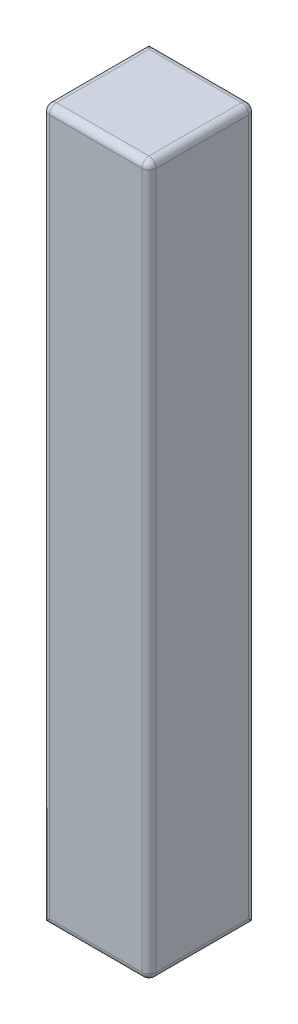
from build123d import *

# Parameters (mm, degrees)
SKETCH1_W           = 3
SKETCH1_H           = 3
BOSS_EXTRUDE1_DEPTH = 20
FILLET1_R           = 0.2


with BuildPart() as part:
    # Sketch1 → Boss-Extrude1 (new body)
    with BuildSketch(Plane(origin=(0, 0, 0), x_dir=(1, 0, 0), z_dir=(0, 1, 0))):
        with Locations((1.5, 1.5)):
            Rectangle(SKETCH1_W, SKETCH1_H)
    extrude(amount=BOSS_EXTRUDE1_DEPTH)

    # Fillet1
    fillet1_edges = [part.edges().sort_by_distance(p)[0] for p in [
        (1.5, 0, 0),
        (3, 0, -1.5),
        (0, 20, -1.5),
        (1.5, 20, 0),
        (3, 20, -1.5),
        (1.5, 20, -3),
        (3, 10, -3),
        (3, 10, 0),
        (0, 10, 0),
    ]]
    fillet(fillet1_edges, radius=FILLET1_R)


solid = part.part
